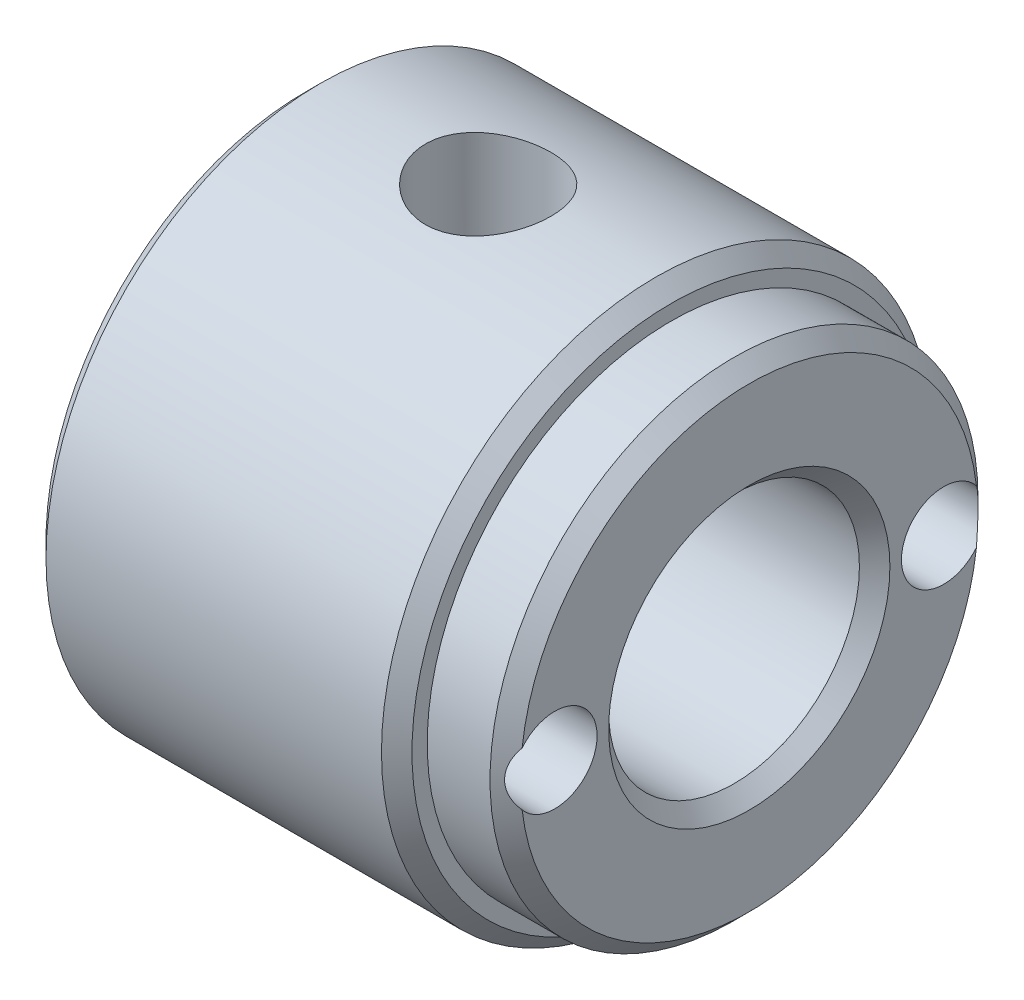
from build123d import *

# Parameters (mm, degrees)
SKETCH1_R                                 = 6.35
SKETCH1_R_2                               = 3.2639
SKETCH1_R_3                               = 1.099999959
INNER_SIDE_EXTRUDE_DEPTH                  = 2.032
OUTER_START                               = -9.525
SKETCH1_3_R                               = 7.14375
SKETCH1_3_R_2                             = 6.35
SKETCH1_3_R_3                             = 3.2639
SKETCH1_3_R_4                             = 1.099999959
OUTER_SIDE_EXTRUDE_DEPTH                  = 9.525
CLEVIS_PIN_CUT_DEPTH                      = 14.8849542
CLEVIS_PIN_CUT_DEPTH_BACK                 = 14.8849542
SKETCH2_R                                 = 1.63195
CHAMFER_SO_STEVE_DOESN_T_CUT_HIMSELF_SIZE = 0.396875


with BuildPart() as part:
    # Sketch1 → Inner Side Extrude (new body)
    with BuildSketch(Plane(origin=(0, 0, 0), x_dir=(0, 0, -1), z_dir=(1, 0, 0))):
        Circle(SKETCH1_R)
        Circle(SKETCH1_R_2, mode=Mode.SUBTRACT)
        with Locations((-5.06095, 0)):
            Circle(SKETCH1_R_3, mode=Mode.SUBTRACT)
        with Locations((5.06095, 0)):
            Circle(SKETCH1_R_3, mode=Mode.SUBTRACT)
    extrude(amount=INNER_SIDE_EXTRUDE_DEPTH)

    # Sketch1<3> → Outer Side Extrude (add)
    # profile 1 of 2: a face of its own
    with BuildSketch(Plane(origin=(0, 0, 0), x_dir=(0, 0, -1), z_dir=(1, 0, 0)).offset(OUTER_START)):
        Circle(SKETCH1_3_R)
        Circle(SKETCH1_3_R_2, mode=Mode.SUBTRACT)
    # profile 2 of 2: a face of its own
    with BuildSketch(Plane(origin=(0, 0, 0), x_dir=(0, 0, -1), z_dir=(1, 0, 0)).offset(OUTER_START)):
        Circle(SKETCH1_3_R_2)
        Circle(SKETCH1_3_R_3, mode=Mode.SUBTRACT)
        with Locations((-5.06095, 0)):
            Circle(SKETCH1_3_R_4, mode=Mode.SUBTRACT)
        with Locations((5.06095, 0)):
            Circle(SKETCH1_3_R_4, mode=Mode.SUBTRACT)
    extrude(amount=OUTER_SIDE_EXTRUDE_DEPTH)

    # Sketch2 → Clevis Pin Cut (cut, two sides: drawn at the far end of the back side and taken through both)
    with BuildSketch(Plane(origin=(0, 0, 0), x_dir=(1, 0, 0), z_dir=(0, 1, 0)).offset(-CLEVIS_PIN_CUT_DEPTH_BACK)):
        with Locations(Location((-4.7625, 0, 0), (0, 0, 270))):
            Circle(SKETCH2_R)
    extrude(amount=CLEVIS_PIN_CUT_DEPTH + CLEVIS_PIN_CUT_DEPTH_BACK, mode=Mode.SUBTRACT)

    # Chamfer so Steve Doesn't cut himself
    # the kernel refuses this chamfer: 0.396875 mm, written as the material it takes off along each edge
    with BuildSketch(Plane(origin=(2.032, 0, 0), x_dir=(0, 0, -1), z_dir=(0, -1, 0))) as chamfer_so_steve_doesn_t_cut_himself_piece_1:
        Polygon((3.2639 + CHAMFER_SO_STEVE_DOESN_T_CUT_HIMSELF_SIZE, 0), (3.2639, -CHAMFER_SO_STEVE_DOESN_T_CUT_HIMSELF_SIZE), (3.2639, 0), align=None)
    revolve(axis=Axis((2.032, 0, 0), (1, 0, 0)), mode=Mode.SUBTRACT)
    with BuildSketch(Plane(origin=(-9.525, 0, 0), x_dir=(0, 0, -1), z_dir=(0, -1, 0))) as chamfer_so_steve_doesn_t_cut_himself_piece_2:
        Polygon((7.14375, CHAMFER_SO_STEVE_DOESN_T_CUT_HIMSELF_SIZE), (7.14375 - CHAMFER_SO_STEVE_DOESN_T_CUT_HIMSELF_SIZE, 0), (7.14375, 0), align=None)
    revolve(axis=Axis((-9.525, 0, 0), (1, 0, 0)), mode=Mode.SUBTRACT)
    with BuildSketch(Plane(origin=(-9.525, 0, 0), x_dir=(0, 0, -1), z_dir=(0, -1, 0))) as chamfer_so_steve_doesn_t_cut_himself_piece_3:
        Polygon((3.2639, CHAMFER_SO_STEVE_DOESN_T_CUT_HIMSELF_SIZE), (3.2639 + CHAMFER_SO_STEVE_DOESN_T_CUT_HIMSELF_SIZE, 0), (3.2639, 0), align=None)
    revolve(axis=Axis((-9.525, 0, 0), (1, 0, 0)), mode=Mode.SUBTRACT)
    with BuildSketch(Plane(origin=(0, 0, 0), x_dir=(0, 0, -1), z_dir=(0, -1, 0))) as chamfer_so_steve_doesn_t_cut_himself_piece_4:
        Polygon((7.14375 - CHAMFER_SO_STEVE_DOESN_T_CUT_HIMSELF_SIZE, 0), (7.14375, -CHAMFER_SO_STEVE_DOESN_T_CUT_HIMSELF_SIZE), (7.14375, 0), align=None)
    revolve(axis=Axis((0, 0, 0), (1, 0, 0)), mode=Mode.SUBTRACT)
    with BuildSketch(Plane(origin=(2.032, 0, 0), x_dir=(0, 0, -1), z_dir=(0, -1, 0))) as chamfer_so_steve_doesn_t_cut_himself_piece_5:
        Polygon((6.35, -CHAMFER_SO_STEVE_DOESN_T_CUT_HIMSELF_SIZE), (6.35 - CHAMFER_SO_STEVE_DOESN_T_CUT_HIMSELF_SIZE, 0), (6.35, 0), align=None)
    revolve(axis=Axis((2.032, 0, 0), (1, 0, 0)), mode=Mode.SUBTRACT)


solid = part.part
